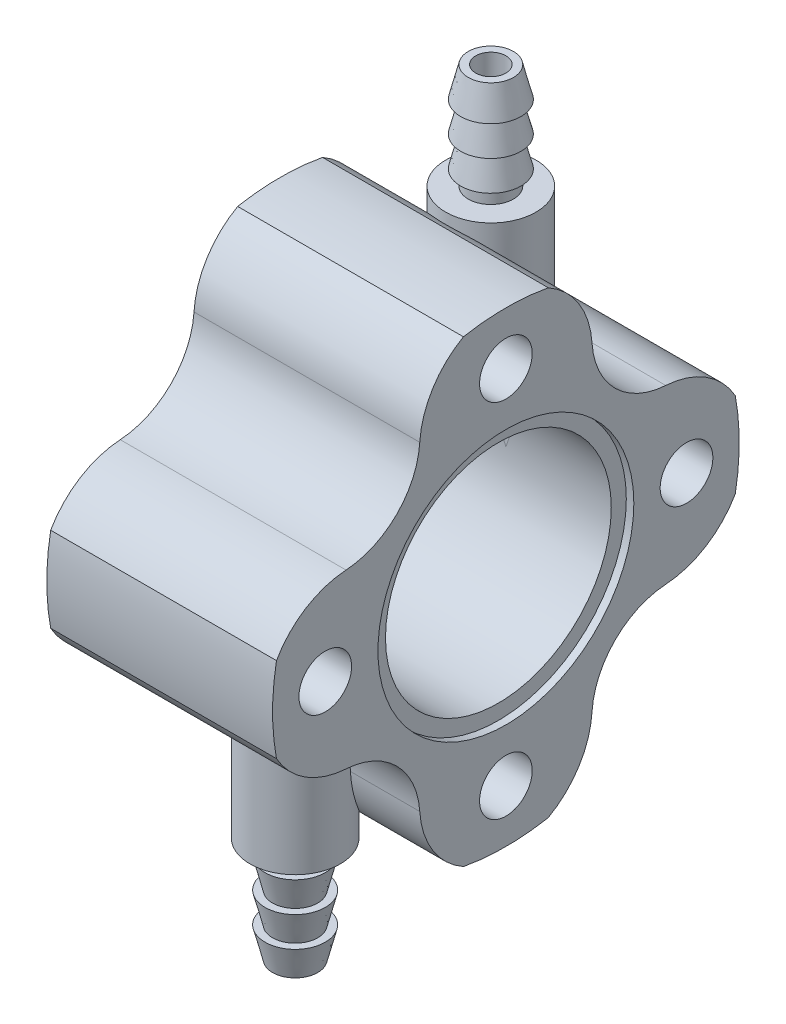
from build123d import *

# Parameters (mm, degrees)
SKETCH2_R           = 1.75
FLANGE_DEPTH        = 15
SKETCH9_R           = 7.5
CUT_EXTRUDE1_DEPTH  = 13.5
SKETCH3_R           = 8.5
O_RING_SEAT_DEPTH   = 0.5
SKETCH5_R           = 1
OUTLET_DEPTH        = 27.561249971
BOSS_EXTRUDE2_REACH = 39.766
SKETCH6_R           = 3
SKETCH6_R_2         = 1
CIRPATTERN1_COUNT   = 2
SKETCH10_W          = 10.606601718
SKETCH10_H          = 10.606601718
CUT_EXTRUDE2_DEPTH  = 0.5
SKETCH12_R          = 0.5
CUT_EXTRUDE3_DEPTH  = 31.700162985
CHAMFER1_SIZE       = 1


with BuildPart() as part:
    # Sketch2 → Flange (new body)
    with BuildSketch(Plane(origin=(0, 0, 0), x_dir=(0, 0, -1), z_dir=(1, 0, 0))):
        with BuildLine():
            ThreePointArc((-15.241152619, 2.820862781), (-15.5, 0), (-15.241152619, -2.820862781))
            ThreePointArc((-15.241152619, -2.820862781), (-13.297993041, -4.855781062), (-10.620697085, -5.721141055))
            ThreePointArc((-10.620697085, -5.721141055), (-7.247844507, -7.247844507), (-5.721141055, -10.620697085))
            ThreePointArc((-5.721141055, -10.620697085), (-4.855781062, -13.297993041), (-2.820862781, -15.241152619))
            ThreePointArc((-2.820862781, -15.241152619), (0, -15.5), (2.820862781, -15.241152619))
            ThreePointArc((2.820862781, -15.241152619), (4.855781062, -13.297993041), (5.721141055, -10.620697085))
            ThreePointArc((5.721141055, -10.620697085), (7.247844507, -7.247844507), (10.620697085, -5.721141055))
            ThreePointArc((10.620697085, -5.721141055), (13.297993041, -4.855781062), (15.241152619, -2.820862781))
            ThreePointArc((15.241152619, -2.820862781), (15.5, 0), (15.241152619, 2.820862781))
            ThreePointArc((15.241152619, 2.820862781), (13.297993041, 4.855781062), (10.620697085, 5.721141055))
            ThreePointArc((10.620697085, 5.721141055), (7.247844507, 7.247844507), (5.721141055, 10.620697085))
            ThreePointArc((5.721141055, 10.620697085), (4.855781062, 13.297993041), (2.820862781, 15.241152619))
            ThreePointArc((2.820862781, 15.241152619), (0, 15.5), (-2.820862781, 15.241152619))
            ThreePointArc((-2.820862781, 15.241152619), (-4.855781062, 13.297993041), (-5.721141055, 10.620697085))
            ThreePointArc((-5.721141055, 10.620697085), (-7.247844507, 7.247844507), (-10.620697085, 5.721141055))
            ThreePointArc((-10.620697085, 5.721141055), (-13.297993041, 4.855781062), (-15.241152619, 2.820862781))
        make_face()
        with Locations((0, 12)):
            Circle(SKETCH2_R, mode=Mode.SUBTRACT)
        with Locations((12, 0)):
            Circle(SKETCH2_R, mode=Mode.SUBTRACT)
        with Locations((0, -12)):
            Circle(SKETCH2_R, mode=Mode.SUBTRACT)
        with Locations((-12, 0)):
            Circle(SKETCH2_R, mode=Mode.SUBTRACT)
    extrude(amount=FLANGE_DEPTH)

    # Sketch9 → Cut-Extrude1 (cut)
    with BuildSketch(Plane(origin=(15, 0, 0), x_dir=(0, 0, -1), z_dir=(1, 0, 0))):
        Circle(SKETCH9_R)
    extrude(amount=-CUT_EXTRUDE1_DEPTH, mode=Mode.SUBTRACT)

    # Sketch3 → O-Ring Seat (cut)
    with BuildSketch(Plane(origin=(15, 0, 0), x_dir=(0, 0, -1), z_dir=(1, 0, 0))):
        Circle(SKETCH3_R)
    extrude(amount=-O_RING_SEAT_DEPTH, mode=Mode.SUBTRACT)

    # Sketch5 → Outlet (cut, through all)
    with BuildSketch(Plane(origin=(0, 0, 0), x_dir=(1, 0, 0), z_dir=(0, 1, 0))):
        with Locations(Location((7.5, 6.5, 0), (0, 0, 90))):
            Circle(SKETCH5_R)
    outlet = extrude(amount=OUTLET_DEPTH, mode=Mode.SUBTRACT)

    # Sketch6 → Boss-Extrude2 (add, up to next)
    with BuildSketch(Plane(origin=(0, 15.5, 0), x_dir=(1, 0, 0), z_dir=(0, 1, 0)), mode=Mode.PRIVATE) as boss_extrude2_sk1:
        with Locations(Location((7.5, 6.5, 0), (0, 0, 270))):
            Circle(SKETCH6_R)
        with Locations(Location((7.5, 6.5, 0), (0, 0, 90))):
            Circle(SKETCH6_R_2, mode=Mode.SUBTRACT)
    boss_extrude2_tool1 = extrude(boss_extrude2_sk1.sketch, amount=-BOSS_EXTRUDE2_REACH, mode=Mode.PRIVATE) - part.part
    boss_extrude2 = boss_extrude2_tool1.solids().sort_by_distance((7.5, 15.5, -9.415147))[0]
    add(boss_extrude2)

    # Sketch8 → Revolve1 (revolve)
    with BuildSketch(Plane.ZY.offset(-7.5), mode=Mode.PRIVATE) as revolve1_sk:
        Polygon((-8, 15.5), (-8, 16.5), (-8.5, 16.5), (-8, 18.5), (-8.5, 18.5), (-8, 20.5), (-8.5, 20.5), (-8, 22.5), (-7.5, 22.5), (-7.5, 15.5), align=None)
    revolve1 = revolve(revolve1_sk.sketch.rotate(Axis((7.5, 15.5, -6.5), (0, -1, 0)), 180), axis=Axis((7.5, 15.5, -6.5), (0, -1, 0)))

    # CirPattern1: Outlet, Boss-Extrude2, Revolve1 ×2 about axis
    cirpattern1_axis = Axis((1.5, 0, 0), (1, 0, 0))
    add([outlet.rotate(cirpattern1_axis, i * 360 / CIRPATTERN1_COUNT) for i in range(1, CIRPATTERN1_COUNT)], mode=Mode.SUBTRACT)
    add([boss_extrude2.rotate(cirpattern1_axis, i * 360 / CIRPATTERN1_COUNT) for i in range(1, CIRPATTERN1_COUNT)])
    add([revolve1.rotate(cirpattern1_axis, i * 360 / CIRPATTERN1_COUNT) for i in range(1, CIRPATTERN1_COUNT)])

    # Sketch10 → Cut-Extrude2 (cut)
    with BuildSketch(Plane(origin=(1.5, 0, 0), x_dir=(0, 0, -1), z_dir=(1, 0, 0))):
        Rectangle(SKETCH10_W, SKETCH10_H)
    extrude(amount=-CUT_EXTRUDE2_DEPTH, mode=Mode.SUBTRACT)

    # Sketch12 → Cut-Extrude3 (cut, through all)
    with BuildSketch(Plane(origin=(1, 0, 0), x_dir=(0, 0, -1), z_dir=(1, 0, 0))):
        with Locations((4.803300859, 4.803300859)):
            Circle(SKETCH12_R)
        with Locations((-4.803300859, -4.803300859)):
            Circle(SKETCH12_R)
    extrude(amount=-CUT_EXTRUDE3_DEPTH, mode=Mode.SUBTRACT)

    # Chamfer1
    chamfer1_edges = [part.edges().sort_by_distance(p)[0] for p in [
        (0, 4.803300859, -4.303300859),
        (0, -4.803300859, 5.303300859),
    ]]
    chamfer(chamfer1_edges, length=CHAMFER1_SIZE - 0.0001)  # a hair under: the kernel refuses the full size


solid = part.part
